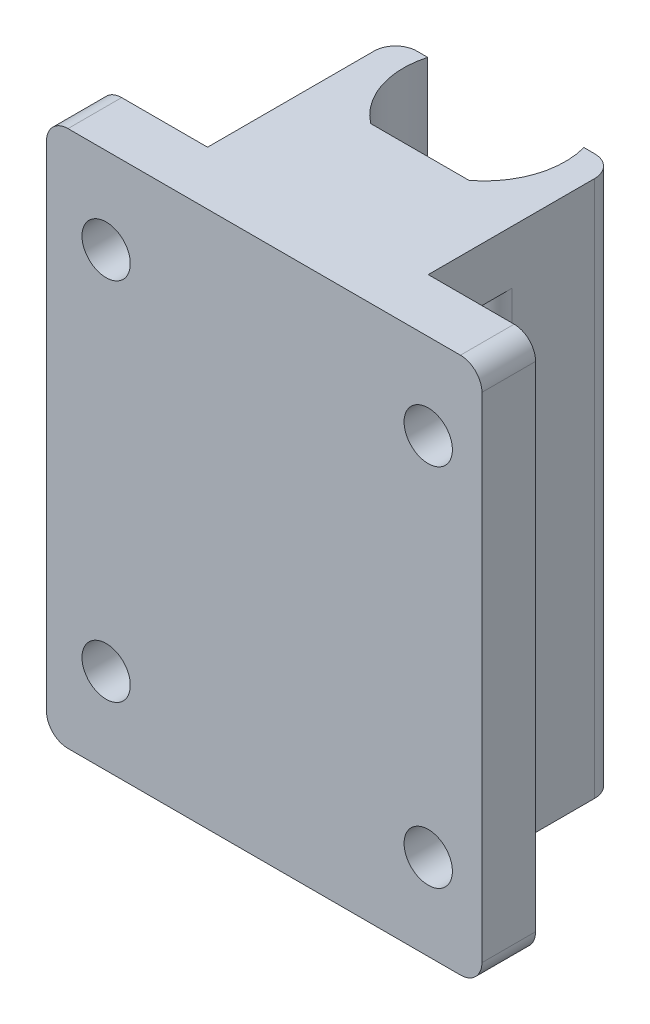
from build123d import *

# Parameters (mm, degrees)
BOSS_EXTRUDE1_DEPTH = 50
SKETCH2_W           = 14.553926362
SKETCH2_H           = 2.5
BOSS_EXTRUDE2_DEPTH = 10
FILLET1_R           = 2
SKETCH3_R           = 2.25
CUT_EXTRUDE1_DEPTH  = 64.645220805
SKETCH4_W           = 2
SKETCH4_H           = 5
CUT_EXTRUDE2_DEPTH  = 63.767765741
FILLET2_R           = 2


with BuildPart() as part:
    # Sketch1 → Boss-Extrude1 (new body)
    with BuildSketch(Plane(origin=(0, 0, 0), x_dir=(1, 0, 0), z_dir=(0, 1, 0))):
        with BuildLine():
            Line((-5.276963181, 0), (35.276963181, 0))
            Line((35.276963181, 0), (35.276963181, 5))
            Line((35.276963181, 5), (25.276963181, 5))
            Line((25.276963181, 5), (25.276963181, 22.5))
            Line((25.276963181, 22.5), (22.276963181, 22.5))
            ThreePointArc((22.276963181, 22.5), (15, 12.953199808), (7.723036819, 22.5))
            Line((7.723036819, 22.5), (4.723036819, 22.5))
            Line((4.723036819, 22.5), (4.723036819, 5))
            Line((4.723036819, 5), (-5.276963181, 5))
            Line((-5.276963181, 5), (-5.276963181, 0))
        make_face()
    extrude(amount=BOSS_EXTRUDE1_DEPTH)

    # Sketch2 → Boss-Extrude2 (add)
    with BuildSketch(Plane(origin=(0, 0, -14.5), x_dir=(-1, 0, 0), z_dir=(0, 0, -1))):
        with Locations((-15, 48.75)):
            Rectangle(SKETCH2_W, SKETCH2_H)
        with Locations((-15, 1.25)):
            Rectangle(SKETCH2_W, SKETCH2_H)
    extrude(amount=-BOSS_EXTRUDE2_DEPTH)

    # Fillet1
    fillet1_edges = [part.edges().sort_by_distance(p)[0] for p in [
        (-5.276963181, 50, -2.5),
        (-5.276963181, 0, -2.5),
        (35.276963181, 50, -2.5),
        (35.276963181, 0, -2.5),
        (4.723036819, 25, -22.5),
        (25.276963181, 25, -22.5),
    ]]
    fillet(fillet1_edges, radius=FILLET1_R)

    # Sketch3 → Cut-Extrude1 (cut, through all)
    with BuildSketch(Plane(origin=(0, 0, -5), x_dir=(-1, 0, 0), z_dir=(0, 0, -1))):
        with Locations((-30.276963181, 42)):
            Circle(SKETCH3_R)
        with Locations((-0.276963181, 42)):
            Circle(SKETCH3_R)
        with Locations((-0.276963181, 8)):
            Circle(SKETCH3_R)
        with Locations((-30.276963181, 8)):
            Circle(SKETCH3_R)
    extrude(amount=-CUT_EXTRUDE1_DEPTH, mode=Mode.SUBTRACT)

    # Sketch4 → Cut-Extrude2 (cut, through all)
    with BuildSketch(Plane.ZY.offset(-4.723036819)):
        with Locations((-9.802694021, 42.5)):
            Rectangle(SKETCH4_W, SKETCH4_H)
        with Locations((-9.802694021, 7.5)):
            Rectangle(SKETCH4_W, SKETCH4_H)
    extrude(amount=-CUT_EXTRUDE2_DEPTH, mode=Mode.SUBTRACT)

    # Fillet2
    fillet2_edges = [part.edges().sort_by_distance(p)[0] for p in [
        (4.723036819, 42.5, -10.802694021),
        (4.723036819, 7.5, -10.802694021),
        (25.276963181, 7.5, -10.802694021),
        (25.276963181, 42.5, -10.802694021),
    ]]
    fillet(fillet2_edges, radius=FILLET2_R)


solid = part.part
